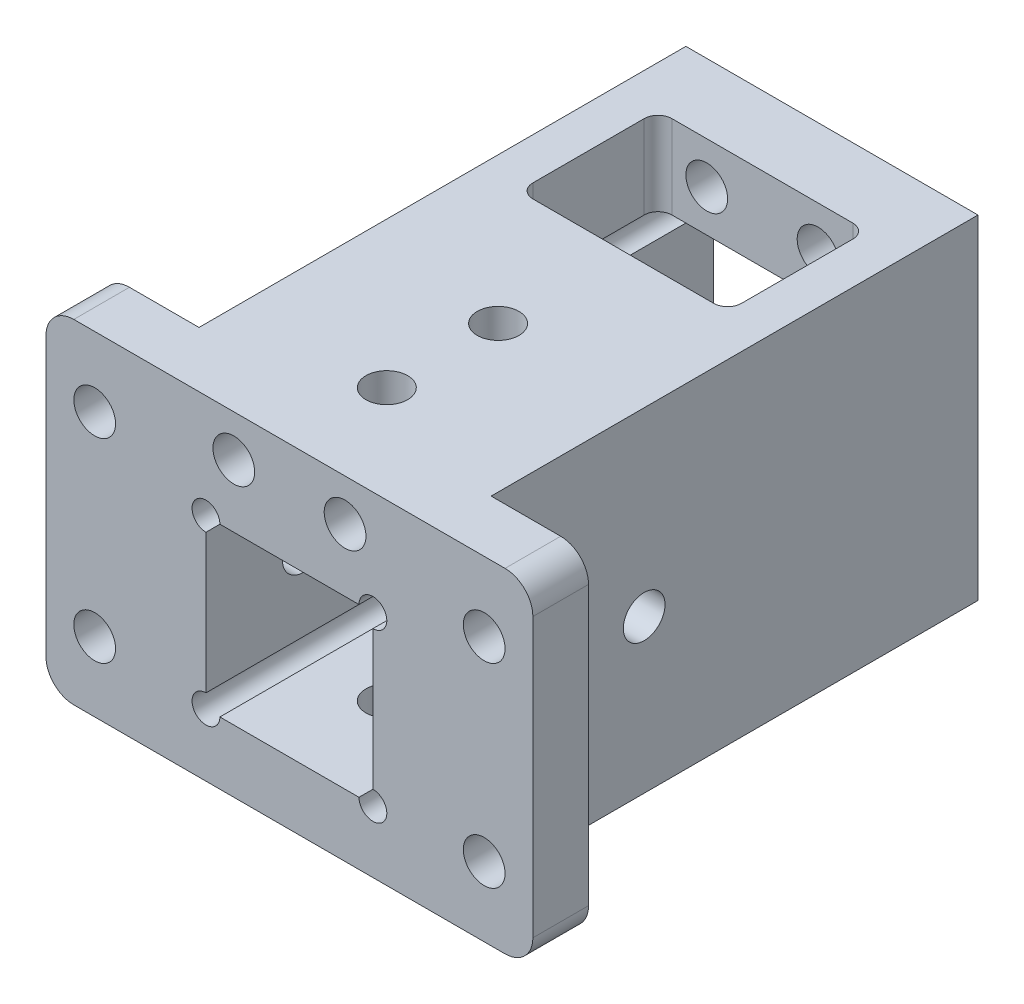
from build123d import *

# Parameters (mm, degrees)
SKETCH_1_W           = 21
SKETCH_1_H           = 24
SKETCH_1_R           = 1.5
SKETCH_1_W_2         = 12
SKETCH_1_H_2         = 12
EXTRUDE_1_DEPTH      = 39
SKETCH_6_W           = 15
SKETCH_6_H           = 15
CUT_EXTRUDE_3_DEPTH  = 20
SKETCH_8_R           = 1.5
CUT_EXTRUDE_4_DEPTH  = 51.378566871
SKETCH_9_R           = 1
CUT_EXTRUDE_5_DEPTH  = 20
SKETCH_13_R          = 1
CUT_EXTRUDE_8_DEPTH  = 38.643060449
SKETCH_14_W          = 7
SKETCH_14_H          = 24
EXTRUDE_2_DEPTH      = 4
SKETCH_15_R          = 1.5
CUT_EXTRUDE_9_DEPTH  = 51.842895276
SKETCH_16_W          = 15
SKETCH_16_H          = 10
CUT_EXTRUDE_10_DEPTH = 54.674947601
SKETCH_17_R          = 1.5
CUT_EXTRUDE_11_DEPTH = 54.674947601
FILLET_1_R           = 1
FILLET_2_R           = 2
CHAMFER_1_SIZE       = 1


with BuildPart() as part:
    # 草图1 → 凸台-拉伸1 (new body)
    with BuildSketch(Plane.XY):
        with Locations((10.5, 12)):
            Rectangle(SKETCH_1_W, SKETCH_1_H)
        with Locations((6.5, 21)):
            Circle(SKETCH_1_R, mode=Mode.SUBTRACT)
        with Locations((14.5, 21)):
            Circle(SKETCH_1_R, mode=Mode.SUBTRACT)
        with Locations((10.5, 10.5)):
            Rectangle(SKETCH_1_W_2, SKETCH_1_H_2, mode=Mode.SUBTRACT)
    extrude(amount=EXTRUDE_1_DEPTH)

    # 草图6 → 切除-拉伸3 (cut)
    with BuildSketch(Plane(origin=(0, 0, 0), x_dir=(-1, 0, 0), z_dir=(0, 0, -1))):
        with Locations((-10.5, 10.5)):
            Rectangle(SKETCH_6_W, SKETCH_6_H)
    extrude(amount=-CUT_EXTRUDE_3_DEPTH, mode=Mode.SUBTRACT)

    # 草图8 → 切除-拉伸4 (cut, through all)
    with BuildSketch(Plane.XZ):
        with Locations(Location((10.5, 32, 0), (0, 0, 270))):
            Circle(SKETCH_8_R)
        with Locations(Location((10.5, 24, 0), (0, 0, 270))):
            Circle(SKETCH_8_R)
    extrude(amount=-CUT_EXTRUDE_4_DEPTH, mode=Mode.SUBTRACT)

    # 草图9 → 切除-拉伸5 (cut)
    with BuildSketch(Plane(origin=(0, 0, 0), x_dir=(-1, 0, 0), z_dir=(0, 0, -1))):
        with Locations((-18, 4)):
            Circle(SKETCH_9_R)
        with Locations((-18, 17)):
            Circle(SKETCH_9_R)
        with Locations((-3, 4)):
            Circle(SKETCH_9_R)
        with Locations((-3, 17)):
            Circle(SKETCH_9_R)
    extrude(amount=-CUT_EXTRUDE_5_DEPTH, mode=Mode.SUBTRACT)

    # 草图13 → 切除-拉伸8 (cut, through all)
    with BuildSketch(Plane(origin=(0, 0, 20), x_dir=(-1, 0, 0), z_dir=(0, 0, -1))):
        with Locations((-16.5, 16.5)):
            Circle(SKETCH_13_R)
        with Locations((-16.5, 4.5)):
            Circle(SKETCH_13_R)
        with Locations((-4.5, 4.5)):
            Circle(SKETCH_13_R)
        with Locations((-4.5, 16.5)):
            Circle(SKETCH_13_R)
    extrude(amount=-CUT_EXTRUDE_8_DEPTH, mode=Mode.SUBTRACT)

    # 草图14 → 凸台-拉伸2 (add)
    with BuildSketch(Plane.XY.offset(39)):
        with Locations((-3.5, 12)):
            Rectangle(SKETCH_14_W, SKETCH_14_H)
        with Locations((24.5, 12)):
            Rectangle(SKETCH_14_W, SKETCH_14_H)
    extrude(amount=-EXTRUDE_2_DEPTH)

    # 草图15 → 切除-拉伸9 (cut, through all)
    with BuildSketch(Plane(origin=(0, 0, 35), x_dir=(-1, 0, 0), z_dir=(0, 0, -1))):
        with Locations((3.5, 5)):
            Circle(SKETCH_15_R)
        with Locations((3.5, 19)):
            Circle(SKETCH_15_R)
        with Locations((-24.5, 5)):
            Circle(SKETCH_15_R)
        with Locations((-24.5, 19)):
            Circle(SKETCH_15_R)
    extrude(amount=-CUT_EXTRUDE_9_DEPTH, mode=Mode.SUBTRACT)

    # 草图16 → 切除-拉伸10 (cut, through all)
    with BuildSketch(Plane(origin=(0, 24, 0), x_dir=(1, 0, 0), z_dir=(0, 1, 0))):
        with Locations((10.5, -10)):
            Rectangle(SKETCH_16_W, SKETCH_16_H)
    extrude(amount=-CUT_EXTRUDE_10_DEPTH, mode=Mode.SUBTRACT)

    # 草图17 → 切除-拉伸11 (cut, through all)
    with BuildSketch(Plane.ZY):
        with Locations((32, 11)):
            Circle(SKETCH_17_R)
        with Locations((24, 11)):
            Circle(SKETCH_17_R)
    extrude(amount=-CUT_EXTRUDE_11_DEPTH, mode=Mode.SUBTRACT)

    # 圆角1
    fillet_1_edges = [part.edges().sort_by_distance(p)[0] for p in [
        (3, 21, 15),
        (3, 1.5, 15),
        (3, 1.5, 5),
        (3, 21, 5),
        (18, 21, 5),
        (18, 1.5, 5),
        (18, 1.5, 15),
        (18, 21, 15),
    ]]
    fillet(fillet_1_edges, radius=FILLET_1_R)

    # 圆角2
    fillet_2_edges = [part.edges().sort_by_distance(p)[0] for p in [
        (-7, 0, 37),
        (-7, 24, 37),
        (28, 24, 37),
        (28, 0, 37),
    ]]
    fillet(fillet_2_edges, radius=FILLET_2_R)

    # 倒角1
    chamfer_1_edges = [part.edges().sort_by_distance(p)[0] for p in [
        (10.5, 3, 0),
        (3, 10.5, 0),
        (18, 10.5, 0),
        (2, 4, 0),
        (19, 4, 0),
    ]]
    chamfer(chamfer_1_edges, length=CHAMFER_1_SIZE - 0.0001)  # a hair under: the kernel refuses the full size


solid = part.part
